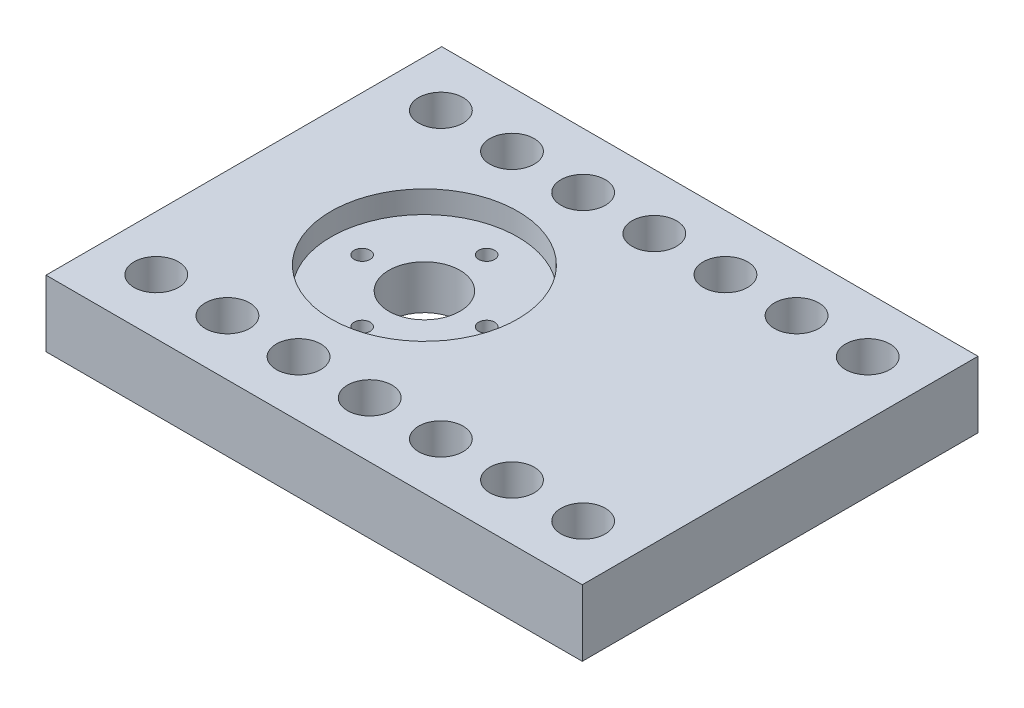
from build123d import *

# Parameters (mm, degrees)
SKETCH3_W           = 60.3
SKETCH3_H           = 44.5
SKETCH3_R           = 0.9
SKETCH3_R_2         = 4
BOSS_EXTRUDE1_DEPTH = 7.46
SKETCH4_R           = 10.5
CUT_EXTRUDE1_DEPTH  = 2.5
SKETCH5_R           = 2.5
CUT_EXTRUDE2_DEPTH  = 39.206499447


with BuildPart() as part:
    # Sketch3 → Boss-Extrude1 (new body)
    with BuildSketch(Plane(origin=(0, 0, 0), x_dir=(1, 0, 0), z_dir=(0, 1, 0))):
        Rectangle(SKETCH3_W, SKETCH3_H)
        with Locations((-9.85, 7)):
            Circle(SKETCH3_R, mode=Mode.SUBTRACT)
        with Locations((-16.85, 0)):
            Circle(SKETCH3_R, mode=Mode.SUBTRACT)
        with Locations((-9.85, -7)):
            Circle(SKETCH3_R, mode=Mode.SUBTRACT)
        with Locations((-2.85, 0)):
            Circle(SKETCH3_R, mode=Mode.SUBTRACT)
        with Locations((-9.85, 0)):
            Circle(SKETCH3_R_2, mode=Mode.SUBTRACT)
    extrude(amount=BOSS_EXTRUDE1_DEPTH)

    # Sketch4 → Cut-Extrude1 (cut)
    with BuildSketch(Plane(origin=(0, 7.46, 0), x_dir=(1, 0, 0), z_dir=(0, 1, 0))):
        with Locations((-9.85, 0)):
            Circle(SKETCH4_R)
    extrude(amount=-CUT_EXTRUDE1_DEPTH, mode=Mode.SUBTRACT)

    # Sketch5 → Cut-Extrude2 (cut, through all)
    with BuildSketch(Plane(origin=(0, 7.46, 0), x_dir=(1, 0, 0), z_dir=(0, 1, 0))):
        with Locations((0, 16)):
            Circle(SKETCH5_R)
        with Locations((8, 16)):
            Circle(SKETCH5_R)
        with Locations((16, 16)):
            Circle(SKETCH5_R)
        with Locations((24, 16)):
            Circle(SKETCH5_R)
        with Locations((-24, 16)):
            Circle(SKETCH5_R)
        with Locations((-16, 16)):
            Circle(SKETCH5_R)
        with Locations((-8, 16)):
            Circle(SKETCH5_R)
        with Locations((-8, -16)):
            Circle(SKETCH5_R)
        with Locations((-16, -16)):
            Circle(SKETCH5_R)
        with Locations((-24, -16)):
            Circle(SKETCH5_R)
        with Locations((24, -16)):
            Circle(SKETCH5_R)
        with Locations((16, -16)):
            Circle(SKETCH5_R)
        with Locations((8, -16)):
            Circle(SKETCH5_R)
        with Locations((0, -16)):
            Circle(SKETCH5_R)
    extrude(amount=-CUT_EXTRUDE2_DEPTH, mode=Mode.SUBTRACT)


solid = part.part
